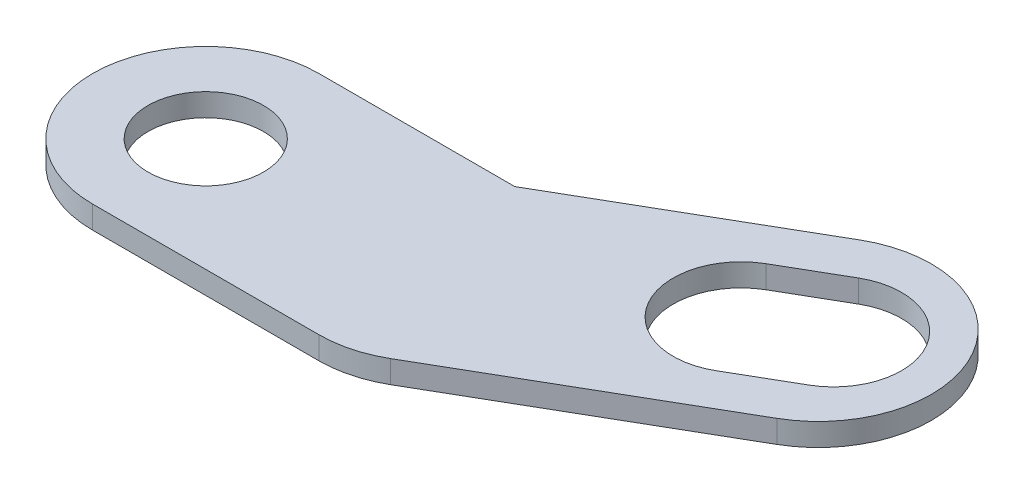
from build123d import *

# Parameters (mm, degrees)
BOSS_EXTRUDE1_DEPTH    = 1
F_10_CLEARANCE_HOLE1_D = 5.1054


with BuildPart() as part:
    # Sketch1 → Boss-Extrude1 (new body)
    # profile 1 of 3: a face of its own
    with BuildSketch(Plane(origin=(0, 0, 0), x_dir=(1, 0, 0), z_dir=(0, 1, 0))):
        with BuildLine():
            Line((0.660254038, 5), (-8, 5))
            ThreePointArc((-8, 5), (-13, 0), (-8, -5))
            Line((-8, -5), (2, -5))
            ThreePointArc((2, -5), (-2.829629131, -1.294095226), (-0.5, 4.330127019))
            Line((-0.5, 4.330127019), (0.660254038, 5))
        make_face()
    # profile 2 of 3: a face of its own
    with BuildSketch(Plane(origin=(0, 0, 0), x_dir=(1, 0, 0), z_dir=(0, 1, 0))):
        with BuildLine():
            Line((2, 5), (0.660254038, 5))
            Line((0.660254038, 5), (-0.5, 4.330127019))
            ThreePointArc((-0.5, 4.330127019), (-2.829629131, -1.294095226), (2, -5))
            ThreePointArc((2, -5), (3.294095226, -4.829629131), (4.5, -4.330127019))
            ThreePointArc((4.5, -4.330127019), (6.829629131, 1.294095226), (2, 5))
        make_face()
    # profile 3 of 3: a face of its own
    with BuildSketch(Plane(origin=(0, 0, 0), x_dir=(1, 0, 0), z_dir=(0, 1, 0))):
        with BuildLine():
            Line((10.325317547, 10.580127019), (0.660254038, 5))
            Line((0.660254038, 5), (2, 5))
            ThreePointArc((2, 5), (6.829629131, 1.294095226), (4.5, -4.330127019))
            Line((4.5, -4.330127019), (15.325317547, 1.919872981))
            ThreePointArc((15.325317547, 1.919872981), (17.155444566, 8.75), (10.325317547, 10.580127019))
        make_face()
        with BuildLine():
            ThreePointArc((12.160254038, 2.401923789), (8.062177826, 3.5), (9.160254038, 7.598076211))
            Line((9.160254038, 7.598076211), (11.758330249, 9.098076211))
            ThreePointArc((11.758330249, 9.098076211), (15.856406461, 8), (14.758330249, 3.901923789))
            Line((14.758330249, 3.901923789), (12.160254038, 2.401923789))
        make_face(mode=Mode.SUBTRACT)
    extrude(amount=BOSS_EXTRUDE1_DEPTH)

    # #10 Clearance Hole1 (through all)
    with Locations(Plane(origin=(0, 1, 0), x_dir=(1, 0, 0), z_dir=(0, 1, 0))):
        with Locations((-8, 0)):
            Hole(F_10_CLEARANCE_HOLE1_D / 2)


solid = part.part
